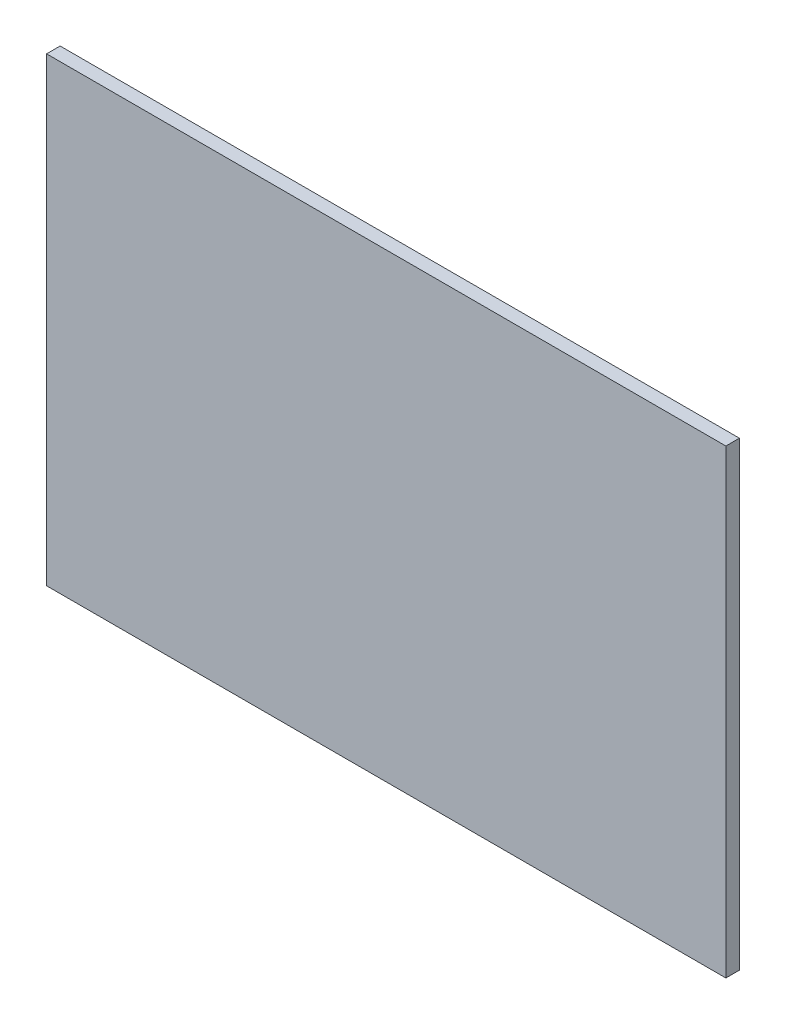
from build123d import *

# Parameters (mm, degrees)
SKETCH1_W           = 159.1564
SKETCH1_H           = 107.95
BOSS_EXTRUDE1_DEPTH = 3.175


with BuildPart() as part:
    # Sketch1 → Boss-Extrude1 (new body)
    with BuildSketch(Plane.XY):
        with Locations((-79.5782, 53.975)):
            Rectangle(SKETCH1_W, SKETCH1_H)
    extrude(amount=BOSS_EXTRUDE1_DEPTH)


solid = part.part
